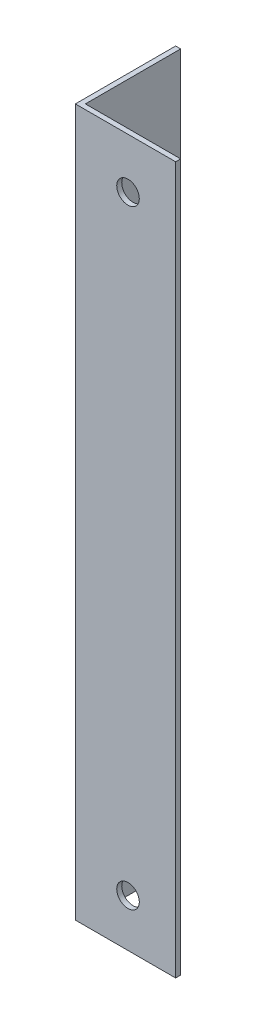
from build123d import *

# Parameters (mm, degrees)
EXTRUDE_1_DEPTH     = 141
SKETCH_2_R          = 2.25
CUT_EXTRUDE_1_DEPTH = 144.673240376


with BuildPart() as part:
    # Эскиз1 → Бобышка-Вытянуть1 (new body)
    with BuildSketch(Plane(origin=(0, 0, 0), x_dir=(1, 0, 0), z_dir=(0, 1, 0))):
        Polygon((0, 0), (0, 20), (1, 20), (1, 1), (20, 1), (20, 0), align=None)
    extrude(amount=EXTRUDE_1_DEPTH)

    # Эскиз2 → Вырез-Вытянуть1 (cut, through all)
    with BuildSketch(Plane(origin=(0, 0, -1), x_dir=(-1, 0, 0), z_dir=(0, 0, -1))):
        with Locations((-10.5, 131)):
            Circle(SKETCH_2_R)
        with Locations((-10.5, 9.5)):
            Circle(SKETCH_2_R)
    extrude(amount=-CUT_EXTRUDE_1_DEPTH, mode=Mode.SUBTRACT)


solid = part.part
